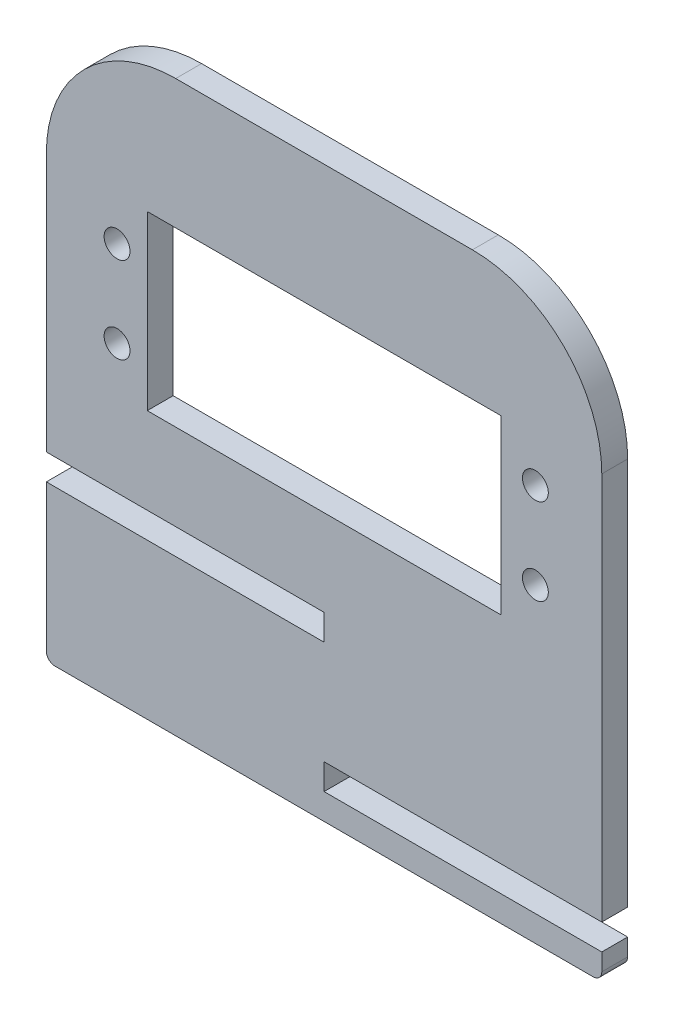
from build123d import *

# Parameters (mm, degrees)
SKETCH1_W           = 41
SKETCH1_H           = 20
BOSS_EXTRUDE7_DEPTH = 3
SKETCH2_R           = 1.5
CUT_EXTRUDE1_DEPTH  = 3


with BuildPart() as part:
    # Sketch1 → Boss-Extrude7 (new body)
    with BuildSketch(Plane.XY):
        with BuildLine():
            Line((-15.261503554, -6.420867766), (-49.661503554, -6.420867766))
            ThreePointArc((-49.661503554, -6.420867766), (-60.268105272, -10.814266048), (-64.661503554, -21.420867766))
            Line((-64.661503554, -21.420867766), (-64.661503554, -51.420867766))
            Line((-64.661503554, -51.420867766), (-32.461503554, -51.420867766))
            Line((-32.461503554, -51.420867766), (-32.461503554, -54.420867766))
            Line((-32.461503554, -54.420867766), (-64.661503554, -54.420867766))
            Line((-64.661503554, -54.420867766), (-64.661503554, -71.420867766))
            ThreePointArc((-64.661503554, -71.420867766), (-64.368610335, -72.127974547), (-63.661503554, -72.420867766))
            Line((-63.661503554, -72.420867766), (-1.261503554, -72.420867766))
            ThreePointArc((-1.261503554, -72.420867766), (-0.554396773, -72.127974547), (-0.261503554, -71.420867766))
            Line((-0.261503554, -71.420867766), (-0.261503554, -69.420867766))
            Line((-0.261503554, -69.420867766), (-32.461503554, -69.420867766))
            Line((-32.461503554, -69.420867766), (-32.461503554, -66.420867766))
            Line((-32.461503554, -66.420867766), (-0.261503554, -66.420867766))
            Line((-0.261503554, -66.420867766), (-0.261503554, -21.420867766))
            ThreePointArc((-0.261503554, -21.420867766), (-4.654901836, -10.814266048), (-15.261503554, -6.420867766))
        make_face()
        with Locations((-32.461503554, -31.420867766)):
            Rectangle(SKETCH1_W, SKETCH1_H, mode=Mode.SUBTRACT)
    extrude(amount=BOSS_EXTRUDE7_DEPTH)

    # Sketch2 → Cut-Extrude1 (cut)
    with BuildSketch(Plane.XY.offset(3)):
        with Locations((-7.961503554, -36.420967032)):
            Circle(SKETCH2_R)
        with Locations((-7.961503554, -26.420967032)):
            Circle(SKETCH2_R)
        with Locations((-56.461503554, -26.420967032)):
            Circle(SKETCH2_R)
        with Locations((-56.461503554, -36.420967032)):
            Circle(SKETCH2_R)
    extrude(amount=-CUT_EXTRUDE1_DEPTH, mode=Mode.SUBTRACT)


solid = part.part
